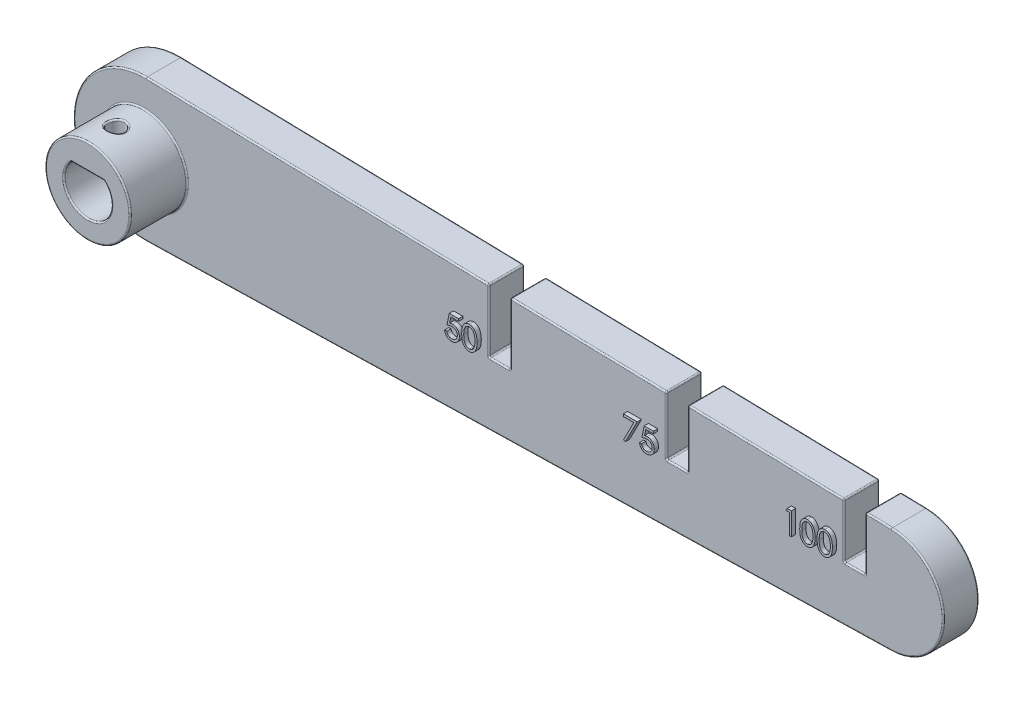
from build123d import *

# Parameters (mm, degrees)
BOSS_EXTRUDE1_DEPTH = 5
CUT_EXTRUDE2_REACH  = 115.054
CUT_EXTRUDE3_REACH  = 115.054
SKETCH4_W           = 3
SKETCH4_H           = 7.656932545
SKETCH4_H_2         = 8.25233943
SKETCH4_H_3         = 8.847746315
SKETCH6_R           = 6
BOSS_EXTRUDE3_DEPTH = 8
CUT_EXTRUDE4_REACH  = 115.689
SKETCH7_R           = 1.15
FILLET1_R           = 0.2
BOSS_EXTRUDE2_DEPTH = 0.6


with BuildPart() as part:
    # Sketch3 → Boss-Extrude1 (new body)
    with BuildSketch(Plane.XY):
        with BuildLine():
            Line((0.238095238, 9.997165131), (105.178571429, 7.497873848))
            ThreePointArc((105.178571429, 7.497873848), (112.5, 0), (105.178571429, -7.497873848))
            Line((105.178571429, -7.497873848), (0.238095238, -9.997165131))
            ThreePointArc((0.238095238, -9.997165131), (-10, 0), (0.238095238, 9.997165131))
        make_face()
    extrude(amount=BOSS_EXTRUDE1_DEPTH)

    # Sketch2 → Cut-Extrude2 (cut, up to next)
    with BuildSketch(Plane.XY, mode=Mode.PRIVATE) as cut_extrude2_sk1:
        with BuildLine():
            Line((-2.3, 2.435672392), (2.3, 2.435672392))
            ThreePointArc((2.3, 2.435672392), (0, -3.35), (-2.3, 2.435672392))
        make_face()
    cut_extrude2_tool1 = extrude(cut_extrude2_sk1.sketch, amount=CUT_EXTRUDE2_REACH, mode=Mode.PRIVATE) & part.part
    add(cut_extrude2_tool1.solids().sort_by_distance((0, -0.250614, 0))[0], mode=Mode.SUBTRACT)

    # Sketch4 → Cut-Extrude3 (cut, up to next)
    with BuildSketch(Plane.XY.offset(5), mode=Mode.PRIVATE) as cut_extrude3_sk1:
        with Locations((100, 3.828466273)):
            Rectangle(SKETCH4_W, SKETCH4_H)
    cut_extrude3_tool1 = extrude(cut_extrude3_sk1.sketch, amount=-CUT_EXTRUDE3_REACH, mode=Mode.PRIVATE) & part.part
    # Sketch4 → Cut-Extrude3 (cut, up to next)
    with BuildSketch(Plane.XY.offset(5), mode=Mode.PRIVATE) as cut_extrude3_sk2:
        with Locations((75, 4.126169715)):
            Rectangle(SKETCH4_W, SKETCH4_H_2)
    cut_extrude3_tool2 = extrude(cut_extrude3_sk2.sketch, amount=-CUT_EXTRUDE3_REACH, mode=Mode.PRIVATE) & part.part
    # Sketch4 → Cut-Extrude3 (cut, up to next)
    with BuildSketch(Plane.XY.offset(5), mode=Mode.PRIVATE) as cut_extrude3_sk3:
        with Locations((50, 4.423873158)):
            Rectangle(SKETCH4_W, SKETCH4_H_3)
    cut_extrude3_tool3 = extrude(cut_extrude3_sk3.sketch, amount=-CUT_EXTRUDE3_REACH, mode=Mode.PRIVATE) & part.part
    add(cut_extrude3_tool1.solids().sort_by_distance((100, 3.828466, 5))[0], mode=Mode.SUBTRACT)
    add(cut_extrude3_tool2.solids().sort_by_distance((75, 4.12617, 5))[0], mode=Mode.SUBTRACT)
    add(cut_extrude3_tool3.solids().sort_by_distance((50, 4.423873, 5))[0], mode=Mode.SUBTRACT)

    # Sketch6 → Boss-Extrude3 (add)
    with BuildSketch(Plane.XY.offset(5)):
        Circle(SKETCH6_R)
        with BuildLine():
            Line((-2.3, 2.435672392), (2.3, 2.435672392))
            ThreePointArc((2.3, 2.435672392), (0, -3.35), (-2.3, 2.435672392))
        make_face(mode=Mode.SUBTRACT)
    extrude(amount=BOSS_EXTRUDE3_DEPTH)

    # Sketch7 → Cut-Extrude4 (cut, up to next)
    with BuildSketch(Plane(origin=(0, 0, 0), x_dir=(1, 0, 0), z_dir=(0, 1, 0)), mode=Mode.PRIVATE) as cut_extrude4_sk1:
        with Locations((0, -9)):
            Circle(SKETCH7_R)
    cut_extrude4_tool1 = extrude(cut_extrude4_sk1.sketch, amount=CUT_EXTRUDE4_REACH, mode=Mode.PRIVATE) & part.part
    add(cut_extrude4_tool1.solids().sort_by_distance((0, 0, 9))[0], mode=Mode.SUBTRACT)

    # Fillet1
    fillet1_edges = [part.edges().sort_by_distance(p)[0] for p in [
        (51.5, 0, 2.5),
        (48.5, 0, 2.5),
        (101.5, 0, 2.5),
        (98.5, 0, 2.5),
        (76.5, 0, 2.5),
        (73.5, 0, 2.5),
        (0, 2.435672392, 0),
        (0, -3.35, 0),
        (76.5, 4.090445302, 0),
        (75, 0, 0),
        (73.5, 4.126169715, 0),
        (62.5, 8.51431846, 0),
        (51.5, 4.388148745, 0),
        (50, 0, 0),
        (48.5, 4.423873158, 0),
        (24.369047619, 9.422455723, 0),
        (-10, 0, 0),
        (52.708333333, -8.74751949, 0),
        (112.5, 0, 0),
        (103.339285714, 7.541678783, 0),
        (101.5, 3.792741859, 0),
        (100, 0, 0),
        (98.5, 3.828466272, 0),
        (87.5, 7.918911574, 0),
        (100, 0, 5),
        (101.5, 3.792741859, 5),
        (103.339285714, 7.541678783, 5),
        (112.5, 0, 5),
        (52.708333333, -8.74751949, 5),
        (-10, 0, 5),
        (24.369047619, 9.422455723, 5),
        (48.5, 4.423873158, 5),
        (50, 0, 5),
        (51.5, 4.388148745, 5),
        (62.5, 8.51431846, 5),
        (73.5, 4.126169715, 5),
        (75, 0, 5),
        (76.5, 4.090445302, 5),
        (87.5, 7.918911574, 5),
        (98.5, 3.828466272, 5),
        (101.5, 7.585483719, 2.5),
        (98.5, 7.656932545, 2.5),
        (76.5, 8.180890604, 2.5),
        (73.5, 8.25233943, 2.5),
        (51.5, 8.776297489, 2.5),
        (48.5, 8.847746315, 2.5),
        (-6, 0, 5),
        (0, 2.435672392, 13),
        (2.3, 2.435672392, 6.5),
        (0, -3.35, 13),
        (-2.3, 2.435672392, 6.5),
        (-1.150000012, 5.888760487, 9.000000001),
        (-1.15, 2.435672392, 9),
        (-6, 0, 13),
    ]]
    fillet(fillet1_edges, radius=FILLET1_R)

    # Sketch5 → Boss-Extrude2 (add)
    # profile 1 of 7: a face of its own
    with BuildSketch(Plane.XY.offset(5)):
        with BuildLine():
            Line((44.816666667, 3.175), (44.816666667, 2.849358974))
            Line((44.816666667, 2.849358974), (43.736708734, 2.849358974))
            Line((43.736708734, 2.849358974), (43.565619992, 2.014267829))
            add(Edge.make_bspline(
                [(43.565619992, 2.014267829), (43.599234964, 2.023548147), (43.664358655, 2.041527295), (43.760479386, 2.061489672), (43.851730885, 2.073523325), (43.910944971, 2.075166443), (43.939598357, 2.075961538)],
                knots=[0, 0, 0, 0, 1.100273476, 2.13160584, 3.095893838, 4, 4, 4, 4], degree=3))
            add(Edge.make_bspline(
                [(43.939598357, 2.075961538), (43.975052893, 2.075194154), (44.044765367, 2.073685284), (44.146763555, 2.059196535), (44.244129822, 2.036391041), (44.336660544, 2.004531711), (44.424526901, 1.963792167), (44.506920474, 1.912901507), (44.58507801, 1.853453414), (44.657597363, 1.785104724), (44.723387271, 1.709882972), (44.781232133, 1.629004046), (44.83036534, 1.543253952), (44.869881167, 1.4518134), (44.901435528, 1.355693311), (44.922437695, 1.253882325), (44.936422852, 1.147340102), (44.937985302, 1.074492385), (44.938782051, 1.037344752)],
                knots=[0, 0, 0, 0, 1.052922333, 2.070308379, 3.05430497, 4.020497103, 4.973039431, 5.925935799, 6.892292201, 7.88610001, 8.88166317, 9.857072816, 10.836096531, 11.812156883, 12.81219415, 13.836441305, 14.89672472, 16, 16, 16, 16], degree=3))
            add(Edge.make_bspline(
                [(44.938782051, 1.037344752), (44.938178733, 1.011471023), (44.93698025, 0.960073227), (44.930885531, 0.883742417), (44.919150989, 0.809027561), (44.903395982, 0.735918748), (44.882946788, 0.664554389), (44.858191718, 0.594730218), (44.82789675, 0.526880824), (44.79466686, 0.460364216), (44.757250412, 0.396684142), (44.715722766, 0.337131132), (44.671848356, 0.28081182), (44.624639385, 0.228330219), (44.573657054, 0.180031196), (44.519518798, 0.135628112), (44.462656617, 0.094370048), (44.40219079, 0.057931757), (44.339468681, 0.024401075), (44.273584512, -0.003106705), (44.20603802, -0.027699827), (44.135857025, -0.047302756), (44.063200495, -0.062663002), (43.987948663, -0.073095689), (43.910496198, -0.080694315), (43.857995294, -0.081169982), (43.831475361, -0.081410256)],
                knots=[0, 0, 0, 0, 1.056347294, 2.098418968, 3.122841568, 4.141288669, 5.149314143, 6.15115421, 7.162517403, 8.180376062, 9.185164535, 10.17417709, 11.141909838, 12.097768115, 13.052685741, 14.0056014, 14.954263652, 15.917497458, 16.885230207, 17.854509472, 18.828990115, 19.81800267, 20.826176721, 21.857883937, 22.917946725, 24, 24, 24, 24], degree=3))
            add(Edge.make_bspline(
                [(43.831475361, -0.081410256), (43.799839497, -0.080783568), (43.737599672, -0.079550632), (43.646413157, -0.066652434), (43.558679194, -0.048179453), (43.47510403, -0.02038798), (43.39493867, 0.014434781), (43.319262347, 0.058445879), (43.246141393, 0.10831978), (43.178548331, 0.167175529), (43.115813857, 0.231506183), (43.05965581, 0.301317758), (43.009641779, 0.375458038), (42.96657268, 0.454287077), (42.929835189, 0.537597745), (42.90097445, 0.625702181), (42.877680514, 0.718140042), (42.867825839, 0.781779298), (42.862820513, 0.814102564)],
                knots=[0, 0, 0, 0, 1.0467383, 2.05933395, 3.04377827, 4.011590433, 4.970194871, 5.932262533, 6.905835911, 7.896367577, 8.894135286, 9.877477877, 10.858688626, 11.851381753, 12.8477658, 13.868841284, 14.917554742, 16, 16, 16, 16], degree=3))
            Line((42.862820513, 0.814102564), (43.14775641, 0.814102564))
            add(Edge.make_bspline(
                [(43.14775641, 0.814102564), (43.154767316, 0.783825354), (43.168242666, 0.725630874), (43.197820738, 0.643868872), (43.233984782, 0.571007861), (43.276987298, 0.506084025), (43.328286254, 0.449470149), (43.386823665, 0.399017529), (43.452453385, 0.353501518), (43.525381529, 0.315562294), (43.602319108, 0.283205639), (43.682843649, 0.261659459), (43.764762592, 0.246509363), (43.820169399, 0.244992837), (43.848011819, 0.244230769)],
                knots=[0, 0, 0, 0, 1.136247022, 2.183929868, 3.172523383, 4.106158343, 5.02341133, 5.958108904, 6.928429099, 7.938127109, 8.96079061, 9.975095812, 10.982467395, 12, 12, 12, 12], degree=3))
            add(Edge.make_bspline(
                [(43.848011819, 0.244230769), (43.875188408, 0.244975332), (43.928699334, 0.246441382), (44.007449663, 0.257725343), (44.083479913, 0.275103997), (44.156039872, 0.301111651), (44.226399269, 0.332720789), (44.292778332, 0.37328375), (44.357097371, 0.419965339), (44.417357178, 0.473447424), (44.472547249, 0.532384219), (44.521311731, 0.59541014), (44.561930788, 0.662644708), (44.596161015, 0.732923925), (44.622153651, 0.807018045), (44.640696541, 0.884579825), (44.65158503, 0.965800843), (44.653082886, 1.021199431), (44.653846154, 1.049429087)],
                knots=[0, 0, 0, 0, 1.027316725, 2.022795036, 3.002884548, 3.971462791, 4.93288096, 5.914575861, 6.907176829, 7.935150275, 8.956128384, 9.956726525, 10.942570165, 11.921478529, 12.907843606, 13.90538589, 14.932640048, 16, 16, 16, 16], degree=3))
            add(Edge.make_bspline(
                [(44.653846154, 1.049429087), (44.653248819, 1.074897804), (44.652079621, 1.124749195), (44.642526889, 1.197682761), (44.625910778, 1.266691878), (44.602847687, 1.33210979), (44.573565563, 1.393998198), (44.537782122, 1.452420974), (44.494825825, 1.506608094), (44.445756755, 1.556584911), (44.392001246, 1.602708476), (44.332634423, 1.642027754), (44.268898632, 1.675105737), (44.201561781, 1.703651707), (44.129022195, 1.724153812), (44.052716392, 1.739546108), (43.971820379, 1.748450044), (43.916511254, 1.749685471), (43.888080929, 1.750320513)],
                knots=[0, 0, 0, 0, 1.045622112, 2.046656509, 3.013763289, 3.955457236, 4.890082067, 5.820317437, 6.762574623, 7.722996705, 8.69280354, 9.665887285, 10.63943826, 11.638615906, 12.663482002, 13.728887084, 14.832589034, 16, 16, 16, 16], degree=3))
            add(Edge.make_bspline(
                [(43.888080929, 1.750320513), (43.863471115, 1.749793834), (43.812658093, 1.748706375), (43.734713815, 1.740699481), (43.652806323, 1.727782407), (43.567249602, 1.710014883), (43.477786713, 1.686763834), (43.384606449, 1.658901395), (43.287512893, 1.625589296), (43.222091814, 1.600432216), (43.188461538, 1.5875)],
                knots=[0, 0, 0, 0, 0.817624296, 1.688186739, 2.600797293, 3.572016777, 4.590301741, 5.671205678, 6.80286297, 8, 8, 8, 8], degree=3))
            Line((43.188461538, 1.5875), (43.514102564, 3.175))
            Line((43.514102564, 3.175), (44.816666667, 3.175))
        make_face()
    # profile 2 of 7: a face of its own
    with BuildSketch(Plane.XY.offset(5)):
        with BuildLine():
            add(Edge.make_bspline(
                [(45.264423077, 1.586227965), (45.264720636, 1.637116309), (45.26529865, 1.735967652), (45.27172886, 1.880008006), (45.282410778, 2.015136268), (45.29704968, 2.141358907), (45.314864134, 2.258708507), (45.338645325, 2.366871466), (45.365689796, 2.466348394), (45.3970338, 2.557463681), (45.432401295, 2.641444883), (45.470895231, 2.719844887), (45.514043295, 2.792545069), (45.559379494, 2.860705779), (45.608739016, 2.923211273), (45.660717205, 2.98094426), (45.717342764, 3.032570441), (45.776690779, 3.079602444), (45.839298571, 3.120831607), (45.903381561, 3.15714702), (45.969380836, 3.188171185), (46.037476588, 3.212564652), (46.107056765, 3.232713063), (46.178364604, 3.246491609), (46.251517842, 3.25516109), (46.300894929, 3.255989917), (46.325936498, 3.256410256)],
                knots=[0, 0, 0, 0, 1.646270934, 3.197905019, 4.663502075, 6.030701355, 7.308322542, 8.50163776, 9.611534131, 10.641858119, 11.616356847, 12.558055219, 13.465016945, 14.349605745, 15.204443733, 16.039544428, 16.859896111, 17.680448484, 18.487036065, 19.28249412, 20.06191084, 20.843045899, 21.620316918, 22.403196591, 23.190181807, 24, 24, 24, 24], degree=3))
            add(Edge.make_bspline(
                [(46.325936498, 3.256410256), (46.351187254, 3.255967738), (46.401403062, 3.255087709), (46.475643974, 3.246629561), (46.548169756, 3.232595043), (46.618671211, 3.212709587), (46.687727449, 3.188039223), (46.754798333, 3.157117338), (46.820300471, 3.121122937), (46.883192946, 3.07882842), (46.944166204, 3.031673069), (47.001722571, 2.978366934), (47.055867284, 2.91944826), (47.107279883, 2.855547427), (47.154501746, 2.785438814), (47.199471931, 2.7103418), (47.239723706, 2.628943087), (47.278490162, 2.542600805), (47.311951928, 2.448925915), (47.342129165, 2.348446454), (47.366512229, 2.239975584), (47.386822498, 2.124082419), (47.402556796, 2.000341345), (47.414016407, 1.869017616), (47.420069849, 1.730024833), (47.421209856, 1.634994498), (47.421794872, 1.586227965)],
                knots=[0, 0, 0, 0, 0.810914788, 1.612654377, 2.396697861, 3.181598691, 3.963628158, 4.749916497, 5.551656086, 6.361998678, 7.18212741, 8.025565596, 8.878627764, 9.750805457, 10.657531673, 11.591944965, 12.560506719, 13.57287815, 14.630710178, 15.753379473, 16.941251878, 18.199788006, 19.531962791, 20.947069417, 22.433333509, 24, 24, 24, 24], degree=3))
            add(Edge.make_bspline(
                [(47.421794872, 1.586227965), (47.421203792, 1.537674134), (47.420052096, 1.443068975), (47.414084269, 1.30470159), (47.402328939, 1.174074794), (47.387624164, 1.050875303), (47.367257933, 0.935615891), (47.342216104, 0.827897713), (47.314411883, 0.727255591), (47.280090319, 0.634514012), (47.242524889, 0.548379235), (47.20165339, 0.467945464), (47.157865762, 0.392501756), (47.110160258, 0.322651986), (47.059311804, 0.257901347), (47.004232096, 0.199392789), (46.946473779, 0.145716537), (46.885321088, 0.097953989), (46.821447752, 0.056148487), (46.756170589, 0.018761637), (46.688331377, -0.011385165), (46.619467484, -0.037270523), (46.548593895, -0.057046647), (46.475798955, -0.070720788), (46.401452941, -0.080310965), (46.351195807, -0.081042557), (46.325936498, -0.081410256)],
                knots=[0, 0, 0, 0, 1.561518951, 3.042555995, 4.452378317, 5.7783523, 7.031515105, 8.214008947, 9.334062868, 10.386615937, 11.391082383, 12.354592575, 13.286541444, 14.194233754, 15.072674879, 15.931287219, 16.775624067, 17.606195743, 18.42308326, 19.229000347, 20.022332153, 20.807536673, 21.593273796, 22.3848459, 23.188221202, 24, 24, 24, 24], degree=3))
            add(Edge.make_bspline(
                [(46.325936498, -0.081410256), (46.300895624, -0.080987205), (46.251519906, -0.080153031), (46.178356634, -0.071522718), (46.107343275, -0.057647511), (46.038129405, -0.038219592), (45.970359924, -0.01443899), (45.904958292, 0.01654328), (45.841197322, 0.052224899), (45.779247125, 0.092860746), (45.720271807, 0.139416844), (45.663939501, 0.190910163), (45.611665377, 0.248625686), (45.56301159, 0.311652088), (45.51677081, 0.379409529), (45.47423545, 0.452823125), (45.434891889, 0.531601779), (45.39892958, 0.616254455), (45.367044721, 0.708016425), (45.338880014, 0.807937466), (45.316642171, 0.916899507), (45.297607633, 1.034027404), (45.2822548, 1.15982447), (45.271773376, 1.294358997), (45.265295184, 1.437547151), (45.264719084, 1.535763303), (45.264423077, 1.586227965)],
                knots=[0, 0, 0, 0, 0.810891512, 1.598919785, 2.382837074, 3.152667961, 3.926044502, 4.706494248, 5.493654104, 6.291793342, 7.103789334, 7.925228297, 8.761435821, 9.622817696, 10.50288917, 11.416980706, 12.369136599, 13.353924996, 14.394355917, 15.514179734, 16.714354668, 17.994756427, 19.357759367, 20.818452758, 22.365282078, 24, 24, 24, 24], degree=3))
        make_face()
        with BuildLine():
            add(Edge.make_bspline(
                [(45.549358974, 1.5875), (45.54946733, 1.545092252), (45.549677627, 1.46278714), (45.555171466, 1.343186467), (45.562655605, 1.231634812), (45.572308782, 1.127990532), (45.586644313, 1.03260445), (45.6027069, 0.944820523), (45.622254095, 0.865103315), (45.645381719, 0.792905801), (45.671724328, 0.727002717), (45.700486076, 0.665678758), (45.731384017, 0.608209501), (45.765963532, 0.555111156), (45.803623625, 0.506210565), (45.843513653, 0.46064221), (45.887122355, 0.420004948), (45.94745075, 0.371267015), (46.027094694, 0.32090323), (46.12744325, 0.27704642), (46.230556774, 0.249485191), (46.300543979, 0.245980213), (46.335476763, 0.244230769)],
                knots=[0, 0, 0, 0, 1.459021318, 2.831673884, 4.118529203, 5.306027144, 6.411944654, 7.436330062, 8.375795394, 9.233974572, 10.042671642, 10.816086306, 11.563610507, 12.285937304, 12.993564865, 13.685989202, 14.367179055, 15.041617293, 16.353048772, 17.594441528, 18.799311195, 20, 20, 20, 20], degree=3))
            add(Edge.make_bspline(
                [(46.335476763, 0.244230769), (46.370635508, 0.245680185), (46.440880408, 0.248576023), (46.543508922, 0.276514878), (46.643140667, 0.318669388), (46.721220213, 0.368514626), (46.780622235, 0.415983896), (46.823182647, 0.456455755), (46.862246077, 0.501772864), (46.899295673, 0.550667225), (46.933276406, 0.604072978), (46.964176538, 0.661733315), (46.992373575, 0.723808354), (47.00843821, 0.767142332), (47.016651643, 0.789297877)],
                knots=[0, 0, 0, 0, 1.353760809, 2.704726607, 4.075137775, 5.516104923, 6.260822281, 7.007110065, 7.778089737, 8.566572457, 9.372053459, 10.217411131, 11.088608312, 12, 12, 12, 12], degree=3))
            add(Edge.make_bspline(
                [(47.016651643, 0.789297877), (47.026223603, 0.817627712), (47.045658789, 0.875149426), (47.070706613, 0.964379311), (47.090432796, 1.057998961), (47.108179564, 1.155448888), (47.120292693, 1.25744776), (47.130042495, 1.36367998), (47.135785332, 1.474225644), (47.136497214, 1.549332529), (47.136858974, 1.5875)],
                knots=[0, 0, 0, 0, 0.884706709, 1.796334032, 2.740027952, 3.714592787, 4.726048262, 5.777819803, 6.87074269, 8, 8, 8, 8], degree=3))
            add(Edge.make_bspline(
                [(47.136858974, 1.5875), (47.136359874, 1.625661298), (47.135383527, 1.700312955), (47.131651553, 1.809640161), (47.122014453, 1.913478773), (47.111310967, 2.01227613), (47.095529202, 2.105485333), (47.078513191, 2.193886682), (47.055652092, 2.276384997), (47.03123201, 2.354271903), (47.00328258, 2.426662497), (46.972516164, 2.493894289), (46.939657854, 2.556291861), (46.903968822, 2.613684015), (46.865872738, 2.666327822), (46.824364104, 2.713167775), (46.781089423, 2.755655596), (46.72047669, 2.804153784), (46.641125013, 2.853603679), (46.542386461, 2.89911119), (46.439633805, 2.925244427), (46.370170743, 2.928928957), (46.335476763, 2.930769231)],
                knots=[0, 0, 0, 0, 1.31362396, 2.569729283, 3.763502607, 4.902122613, 5.988968491, 7.01645872, 7.998833611, 8.933434873, 9.825090667, 10.667526885, 11.477055099, 12.250526234, 12.991942729, 13.710640831, 14.402115721, 15.076753259, 16.378508321, 17.609869233, 18.806226677, 20, 20, 20, 20], degree=3))
            add(Edge.make_bspline(
                [(46.335476763, 2.930769231), (46.300360726, 2.928926418), (46.230064678, 2.925237437), (46.126244034, 2.899208557), (46.026726515, 2.853839652), (45.947584674, 2.80399), (45.886929667, 2.756511674), (45.844218938, 2.715339677), (45.804172053, 2.670303432), (45.76728064, 2.620953123), (45.732728219, 2.567916683), (45.700995443, 2.510776875), (45.672404722, 2.449244137), (45.646020893, 2.383370657), (45.622822721, 2.311179371), (45.603687483, 2.231560356), (45.586009942, 2.144055639), (45.573495662, 2.048152943), (45.562370684, 1.944482704), (45.555221175, 1.832652565), (45.549659249, 1.712851306), (45.549461071, 1.630120641), (45.549358974, 1.5875)],
                knots=[0, 0, 0, 0, 1.207732386, 2.417664972, 3.655092373, 4.956220595, 5.625982001, 6.301752483, 6.994047911, 7.697131622, 8.419323945, 9.170223765, 9.943494443, 10.752040957, 11.610060368, 12.549350801, 13.567764191, 14.679664412, 15.874934091, 17.154273443, 18.533957287, 20, 20, 20, 20], degree=3))
        make_face(mode=Mode.SUBTRACT)
    # profile 3 of 7: a face of its own
    with BuildSketch(Plane.XY.offset(5)):
        Polygon((68.025641026, 3.175), (69.979487179, 3.175), (68.310576923, -0.081410256), (68.064438101, 0.054061498), (69.497385817, 2.849358974), (68.025641026, 2.849358974), align=None)
    # profile 4 of 7: a face of its own
    with BuildSketch(Plane.XY.offset(5)):
        with BuildLine():
            Line((72.258974359, 3.175), (72.258974359, 2.849358974))
            Line((72.258974359, 2.849358974), (71.179016426, 2.849358974))
            Line((71.179016426, 2.849358974), (71.007927684, 2.014267829))
            add(Edge.make_bspline(
                [(71.007927684, 2.014267829), (71.041542656, 2.023548147), (71.106666347, 2.041527295), (71.202787078, 2.061489672), (71.294038577, 2.073523325), (71.353252663, 2.075166443), (71.38190605, 2.075961538)],
                knots=[0, 0, 0, 0, 1.100273476, 2.13160584, 3.095893838, 4, 4, 4, 4], degree=3))
            add(Edge.make_bspline(
                [(71.38190605, 2.075961538), (71.417360585, 2.075194154), (71.48707306, 2.073685284), (71.589071247, 2.059196535), (71.686437515, 2.036391041), (71.778968236, 2.004531711), (71.866834593, 1.963792167), (71.949228167, 1.912901507), (72.027385702, 1.853453414), (72.099905055, 1.785104724), (72.165694963, 1.709882972), (72.223539825, 1.629004046), (72.272673032, 1.543253952), (72.31218886, 1.4518134), (72.34374322, 1.355693311), (72.364745387, 1.253882325), (72.378730544, 1.147340102), (72.380292995, 1.074492385), (72.381089744, 1.037344752)],
                knots=[0, 0, 0, 0, 1.052922333, 2.070308379, 3.05430497, 4.020497103, 4.973039431, 5.925935799, 6.892292201, 7.88610001, 8.88166317, 9.857072816, 10.836096531, 11.812156883, 12.81219415, 13.836441305, 14.89672472, 16, 16, 16, 16], degree=3))
            add(Edge.make_bspline(
                [(72.381089744, 1.037344752), (72.380486425, 1.011471023), (72.379287942, 0.960073227), (72.373193223, 0.883742417), (72.361458681, 0.809027561), (72.345703674, 0.735918748), (72.325254481, 0.664554389), (72.30049941, 0.594730218), (72.270204442, 0.526880824), (72.236974552, 0.460364216), (72.199558104, 0.396684142), (72.158030458, 0.337131132), (72.114156048, 0.28081182), (72.066947077, 0.228330219), (72.015964746, 0.180031196), (71.96182649, 0.135628112), (71.904964309, 0.094370048), (71.844498482, 0.057931757), (71.781776373, 0.024401075), (71.715892204, -0.003106705), (71.648345712, -0.027699827), (71.578164718, -0.047302756), (71.505508188, -0.062663002), (71.430256356, -0.073095689), (71.352803891, -0.080694315), (71.300302986, -0.081169982), (71.273783053, -0.081410256)],
                knots=[0, 0, 0, 0, 1.056347294, 2.098418968, 3.122841568, 4.141288669, 5.149314143, 6.15115421, 7.162517403, 8.180376062, 9.185164535, 10.17417709, 11.141909838, 12.097768115, 13.052685741, 14.0056014, 14.954263652, 15.917497458, 16.885230207, 17.854509472, 18.828990115, 19.81800267, 20.826176721, 21.857883937, 22.917946725, 24, 24, 24, 24], degree=3))
            add(Edge.make_bspline(
                [(71.273783053, -0.081410256), (71.242147189, -0.080783568), (71.179907364, -0.079550632), (71.08872085, -0.066652434), (71.000986886, -0.048179453), (70.917411723, -0.02038798), (70.837246362, 0.014434781), (70.761570039, 0.058445879), (70.688449085, 0.10831978), (70.620856024, 0.167175529), (70.558121549, 0.231506183), (70.501963502, 0.301317758), (70.451949471, 0.375458038), (70.408880372, 0.454287077), (70.372142882, 0.537597745), (70.343282142, 0.625702181), (70.319988206, 0.718140042), (70.310133532, 0.781779298), (70.305128205, 0.814102564)],
                knots=[0, 0, 0, 0, 1.0467383, 2.05933395, 3.04377827, 4.011590433, 4.970194871, 5.932262533, 6.905835911, 7.896367577, 8.894135286, 9.877477877, 10.858688626, 11.851381753, 12.8477658, 13.868841284, 14.917554742, 16, 16, 16, 16], degree=3))
            Line((70.305128205, 0.814102564), (70.590064103, 0.814102564))
            add(Edge.make_bspline(
                [(70.590064103, 0.814102564), (70.597075008, 0.783825354), (70.610550358, 0.725630874), (70.64012843, 0.643868872), (70.676292474, 0.571007861), (70.71929499, 0.506084025), (70.770593947, 0.449470149), (70.829131357, 0.399017529), (70.894761078, 0.353501518), (70.967689221, 0.315562294), (71.044626801, 0.283205639), (71.125151341, 0.261659459), (71.207070284, 0.246509363), (71.262477091, 0.244992837), (71.290319511, 0.244230769)],
                knots=[0, 0, 0, 0, 1.136247022, 2.183929868, 3.172523383, 4.106158343, 5.02341133, 5.958108904, 6.928429099, 7.938127109, 8.96079061, 9.975095812, 10.982467395, 12, 12, 12, 12], degree=3))
            add(Edge.make_bspline(
                [(71.290319511, 0.244230769), (71.3174961, 0.244975332), (71.371007026, 0.246441382), (71.449757355, 0.257725343), (71.525787605, 0.275103997), (71.598347565, 0.301111651), (71.668706961, 0.332720789), (71.735086025, 0.37328375), (71.799405063, 0.419965339), (71.85966487, 0.473447424), (71.914854942, 0.532384219), (71.963619423, 0.59541014), (72.00423848, 0.662644708), (72.038468708, 0.732923925), (72.064461343, 0.807018045), (72.083004233, 0.884579825), (72.093892722, 0.965800843), (72.095390578, 1.021199431), (72.096153846, 1.049429087)],
                knots=[0, 0, 0, 0, 1.027316725, 2.022795036, 3.002884548, 3.971462791, 4.93288096, 5.914575861, 6.907176829, 7.935150275, 8.956128384, 9.956726525, 10.942570165, 11.921478529, 12.907843606, 13.90538589, 14.932640048, 16, 16, 16, 16], degree=3))
            add(Edge.make_bspline(
                [(72.096153846, 1.049429087), (72.095556511, 1.074897804), (72.094387313, 1.124749195), (72.084834581, 1.197682761), (72.068218471, 1.266691878), (72.04515538, 1.33210979), (72.015873255, 1.393998198), (71.980089814, 1.452420974), (71.937133518, 1.506608094), (71.888064447, 1.556584911), (71.834308939, 1.602708476), (71.774942115, 1.642027754), (71.711206324, 1.675105737), (71.643869473, 1.703651707), (71.571329887, 1.724153812), (71.495024085, 1.739546108), (71.414128071, 1.748450044), (71.358818947, 1.749685471), (71.330388622, 1.750320513)],
                knots=[0, 0, 0, 0, 1.045622112, 2.046656509, 3.013763289, 3.955457236, 4.890082067, 5.820317437, 6.762574623, 7.722996705, 8.69280354, 9.665887285, 10.63943826, 11.638615906, 12.663482002, 13.728887084, 14.832589034, 16, 16, 16, 16], degree=3))
            add(Edge.make_bspline(
                [(71.330388622, 1.750320513), (71.305778808, 1.749793834), (71.254965785, 1.748706375), (71.177021507, 1.740699481), (71.095114015, 1.727782407), (71.009557294, 1.710014883), (70.920094405, 1.686763834), (70.826914141, 1.658901395), (70.729820585, 1.625589296), (70.664399507, 1.600432216), (70.630769231, 1.5875)],
                knots=[0, 0, 0, 0, 0.817624296, 1.688186739, 2.600797293, 3.572016777, 4.590301741, 5.671205678, 6.80286297, 8, 8, 8, 8], degree=3))
            Line((70.630769231, 1.5875), (70.956410256, 3.175))
            Line((70.956410256, 3.175), (72.258974359, 3.175))
        make_face()
    # profile 5 of 7: a face of its own
    with BuildSketch(Plane.XY.offset(5)):
        Polygon((91.096930088, 3.175), (91.683974359, 3.175), (91.683974359, 0), (91.399038462, 0), (91.399038462, 2.849358974), (90.910576923, 2.849358974), align=None)
    # profile 6 of 7: a face of its own
    with BuildSketch(Plane.XY.offset(5)):
        with BuildLine():
            add(Edge.make_bspline(
                [(92.864423077, 1.586227965), (92.864720636, 1.637116309), (92.86529865, 1.735967652), (92.87172886, 1.880008006), (92.882410778, 2.015136268), (92.89704968, 2.141358907), (92.914864134, 2.258708507), (92.938645325, 2.366871466), (92.965689796, 2.466348394), (92.9970338, 2.557463681), (93.032401295, 2.641444883), (93.070895231, 2.719844887), (93.114043295, 2.792545069), (93.159379494, 2.860705779), (93.208739016, 2.923211273), (93.260717205, 2.98094426), (93.317342764, 3.032570441), (93.376690779, 3.079602444), (93.439298571, 3.120831607), (93.503381561, 3.15714702), (93.569380836, 3.188171185), (93.637476588, 3.212564652), (93.707056765, 3.232713063), (93.778364604, 3.246491609), (93.851517842, 3.25516109), (93.900894929, 3.255989917), (93.925936498, 3.256410256)],
                knots=[0, 0, 0, 0, 1.646270934, 3.197905019, 4.663502075, 6.030701355, 7.308322542, 8.50163776, 9.611534131, 10.641858119, 11.616356847, 12.558055219, 13.465016945, 14.349605745, 15.204443733, 16.039544428, 16.859896111, 17.680448484, 18.487036065, 19.28249412, 20.06191084, 20.843045899, 21.620316918, 22.403196591, 23.190181807, 24, 24, 24, 24], degree=3))
            add(Edge.make_bspline(
                [(93.925936498, 3.256410256), (93.951187254, 3.255967738), (94.001403062, 3.255087709), (94.075643974, 3.246629561), (94.148169756, 3.232595043), (94.218671211, 3.212709587), (94.287727449, 3.188039223), (94.354798333, 3.157117338), (94.420300471, 3.121122937), (94.483192946, 3.07882842), (94.544166204, 3.031673069), (94.601722571, 2.978366934), (94.655867284, 2.91944826), (94.707279883, 2.855547427), (94.754501746, 2.785438814), (94.799471931, 2.7103418), (94.839723706, 2.628943087), (94.878490162, 2.542600805), (94.911951928, 2.448925915), (94.942129165, 2.348446454), (94.966512229, 2.239975584), (94.986822498, 2.124082419), (95.002556796, 2.000341345), (95.014016407, 1.869017616), (95.020069849, 1.730024833), (95.021209856, 1.634994498), (95.021794872, 1.586227965)],
                knots=[0, 0, 0, 0, 0.810914788, 1.612654377, 2.396697861, 3.181598691, 3.963628158, 4.749916497, 5.551656086, 6.361998678, 7.18212741, 8.025565596, 8.878627764, 9.750805457, 10.657531673, 11.591944965, 12.560506719, 13.57287815, 14.630710178, 15.753379473, 16.941251878, 18.199788006, 19.531962791, 20.947069417, 22.433333509, 24, 24, 24, 24], degree=3))
            add(Edge.make_bspline(
                [(95.021794872, 1.586227965), (95.021203792, 1.537674134), (95.020052096, 1.443068975), (95.014084269, 1.30470159), (95.002328939, 1.174074794), (94.987624164, 1.050875303), (94.967257933, 0.935615891), (94.942216104, 0.827897713), (94.914411883, 0.727255591), (94.880090319, 0.634514012), (94.842524889, 0.548379235), (94.80165339, 0.467945464), (94.757865762, 0.392501756), (94.710160258, 0.322651986), (94.659311804, 0.257901347), (94.604232096, 0.199392789), (94.546473779, 0.145716537), (94.485321088, 0.097953989), (94.421447752, 0.056148487), (94.356170589, 0.018761637), (94.288331377, -0.011385165), (94.219467484, -0.037270523), (94.148593895, -0.057046647), (94.075798955, -0.070720788), (94.001452941, -0.080310965), (93.951195807, -0.081042557), (93.925936498, -0.081410256)],
                knots=[0, 0, 0, 0, 1.561518951, 3.042555995, 4.452378317, 5.7783523, 7.031515105, 8.214008947, 9.334062868, 10.386615937, 11.391082383, 12.354592575, 13.286541444, 14.194233754, 15.072674879, 15.931287219, 16.775624067, 17.606195743, 18.42308326, 19.229000347, 20.022332153, 20.807536673, 21.593273796, 22.3848459, 23.188221202, 24, 24, 24, 24], degree=3))
            add(Edge.make_bspline(
                [(93.925936498, -0.081410256), (93.900895624, -0.080987205), (93.851519906, -0.080153031), (93.778356634, -0.071522718), (93.707343275, -0.057647511), (93.638129405, -0.038219592), (93.570359924, -0.01443899), (93.504958292, 0.01654328), (93.441197322, 0.052224899), (93.379247125, 0.092860746), (93.320271807, 0.139416844), (93.263939501, 0.190910163), (93.211665377, 0.248625686), (93.16301159, 0.311652088), (93.11677081, 0.379409529), (93.07423545, 0.452823125), (93.034891889, 0.531601779), (92.99892958, 0.616254455), (92.967044721, 0.708016425), (92.938880014, 0.807937466), (92.916642171, 0.916899507), (92.897607633, 1.034027404), (92.8822548, 1.15982447), (92.871773376, 1.294358997), (92.865295184, 1.437547151), (92.864719084, 1.535763303), (92.864423077, 1.586227965)],
                knots=[0, 0, 0, 0, 0.810891512, 1.598919785, 2.382837074, 3.152667961, 3.926044502, 4.706494248, 5.493654104, 6.291793342, 7.103789334, 7.925228297, 8.761435821, 9.622817696, 10.50288917, 11.416980706, 12.369136599, 13.353924996, 14.394355917, 15.514179734, 16.714354668, 17.994756427, 19.357759367, 20.818452758, 22.365282078, 24, 24, 24, 24], degree=3))
        make_face()
        with BuildLine():
            add(Edge.make_bspline(
                [(93.149358974, 1.5875), (93.14946733, 1.545092252), (93.149677627, 1.46278714), (93.155171466, 1.343186467), (93.162655605, 1.231634812), (93.172308782, 1.127990532), (93.186644313, 1.03260445), (93.2027069, 0.944820523), (93.222254095, 0.865103315), (93.245381719, 0.792905801), (93.271724328, 0.727002717), (93.300486076, 0.665678758), (93.331384017, 0.608209501), (93.365963532, 0.555111156), (93.403623625, 0.506210565), (93.443513653, 0.46064221), (93.487122355, 0.420004948), (93.54745075, 0.371267015), (93.627094694, 0.32090323), (93.72744325, 0.27704642), (93.830556774, 0.249485191), (93.900543979, 0.245980213), (93.935476763, 0.244230769)],
                knots=[0, 0, 0, 0, 1.459021318, 2.831673884, 4.118529203, 5.306027144, 6.411944654, 7.436330062, 8.375795394, 9.233974572, 10.042671642, 10.816086306, 11.563610507, 12.285937304, 12.993564865, 13.685989202, 14.367179055, 15.041617293, 16.353048772, 17.594441528, 18.799311195, 20, 20, 20, 20], degree=3))
            add(Edge.make_bspline(
                [(93.935476763, 0.244230769), (93.970635508, 0.245680185), (94.040880408, 0.248576023), (94.143508922, 0.276514878), (94.243140667, 0.318669388), (94.321220213, 0.368514626), (94.380622235, 0.415983896), (94.423182647, 0.456455755), (94.462246077, 0.501772864), (94.499295673, 0.550667225), (94.533276406, 0.604072978), (94.564176538, 0.661733315), (94.592373575, 0.723808354), (94.60843821, 0.767142332), (94.616651643, 0.789297877)],
                knots=[0, 0, 0, 0, 1.353760809, 2.704726607, 4.075137775, 5.516104923, 6.260822281, 7.007110065, 7.778089737, 8.566572457, 9.372053459, 10.217411131, 11.088608312, 12, 12, 12, 12], degree=3))
            add(Edge.make_bspline(
                [(94.616651643, 0.789297877), (94.626223603, 0.817627712), (94.645658789, 0.875149426), (94.670706613, 0.964379311), (94.690432796, 1.057998961), (94.708179564, 1.155448888), (94.720292693, 1.25744776), (94.730042495, 1.36367998), (94.735785332, 1.474225644), (94.736497214, 1.549332529), (94.736858974, 1.5875)],
                knots=[0, 0, 0, 0, 0.884706709, 1.796334032, 2.740027952, 3.714592787, 4.726048262, 5.777819803, 6.87074269, 8, 8, 8, 8], degree=3))
            add(Edge.make_bspline(
                [(94.736858974, 1.5875), (94.736359874, 1.625661298), (94.735383527, 1.700312955), (94.731651553, 1.809640161), (94.722014453, 1.913478773), (94.711310967, 2.01227613), (94.695529202, 2.105485333), (94.678513191, 2.193886682), (94.655652092, 2.276384997), (94.63123201, 2.354271903), (94.60328258, 2.426662497), (94.572516164, 2.493894289), (94.539657854, 2.556291861), (94.503968822, 2.613684015), (94.465872738, 2.666327822), (94.424364104, 2.713167775), (94.381089423, 2.755655596), (94.32047669, 2.804153784), (94.241125013, 2.853603679), (94.142386461, 2.89911119), (94.039633805, 2.925244427), (93.970170743, 2.928928957), (93.935476763, 2.930769231)],
                knots=[0, 0, 0, 0, 1.31362396, 2.569729283, 3.763502607, 4.902122613, 5.988968491, 7.01645872, 7.998833611, 8.933434873, 9.825090667, 10.667526885, 11.477055099, 12.250526234, 12.991942729, 13.710640831, 14.402115721, 15.076753259, 16.378508321, 17.609869233, 18.806226677, 20, 20, 20, 20], degree=3))
            add(Edge.make_bspline(
                [(93.935476763, 2.930769231), (93.900360726, 2.928926418), (93.830064678, 2.925237437), (93.726244034, 2.899208557), (93.626726515, 2.853839652), (93.547584674, 2.80399), (93.486929667, 2.756511674), (93.444218938, 2.715339677), (93.404172053, 2.670303432), (93.36728064, 2.620953123), (93.332728219, 2.567916683), (93.300995443, 2.510776875), (93.272404722, 2.449244137), (93.246020893, 2.383370657), (93.222822721, 2.311179371), (93.203687483, 2.231560356), (93.186009942, 2.144055639), (93.173495662, 2.048152943), (93.162370684, 1.944482704), (93.155221175, 1.832652565), (93.149659249, 1.712851306), (93.149461071, 1.630120641), (93.149358974, 1.5875)],
                knots=[0, 0, 0, 0, 1.207732386, 2.417664972, 3.655092373, 4.956220595, 5.625982001, 6.301752483, 6.994047911, 7.697131622, 8.419323945, 9.170223765, 9.943494443, 10.752040957, 11.610060368, 12.549350801, 13.567764191, 14.679664412, 15.874934091, 17.154273443, 18.533957287, 20, 20, 20, 20], degree=3))
        make_face(mode=Mode.SUBTRACT)
    # profile 7 of 7: a face of its own
    with BuildSketch(Plane.XY.offset(5)):
        with BuildLine():
            add(Edge.make_bspline(
                [(95.306730769, 1.586227965), (95.307028329, 1.637116309), (95.307606342, 1.735967652), (95.314036552, 1.880008006), (95.32471847, 2.015136268), (95.339357372, 2.141358907), (95.357171826, 2.258708507), (95.380953017, 2.366871466), (95.407997488, 2.466348394), (95.439341493, 2.557463681), (95.474708987, 2.641444883), (95.513202924, 2.719844887), (95.556350987, 2.792545069), (95.601687187, 2.860705779), (95.651046709, 2.923211273), (95.703024897, 2.98094426), (95.759650456, 3.032570441), (95.818998471, 3.079602444), (95.881606264, 3.120831607), (95.945689254, 3.15714702), (96.011688528, 3.188171185), (96.07978428, 3.212564652), (96.149364458, 3.232713063), (96.220672297, 3.246491609), (96.293825534, 3.25516109), (96.343202621, 3.255989917), (96.368244191, 3.256410256)],
                knots=[0, 0, 0, 0, 1.646270934, 3.197905019, 4.663502075, 6.030701355, 7.308322542, 8.50163776, 9.611534131, 10.641858119, 11.616356847, 12.558055219, 13.465016945, 14.349605745, 15.204443733, 16.039544428, 16.859896111, 17.680448484, 18.487036065, 19.28249412, 20.06191084, 20.843045899, 21.620316918, 22.403196591, 23.190181807, 24, 24, 24, 24], degree=3))
            add(Edge.make_bspline(
                [(96.368244191, 3.256410256), (96.393494946, 3.255967738), (96.443710754, 3.255087709), (96.517951666, 3.246629561), (96.590477449, 3.232595043), (96.660978903, 3.212709587), (96.730035141, 3.188039223), (96.797106025, 3.157117338), (96.862608163, 3.121122937), (96.925500638, 3.07882842), (96.986473897, 3.031673069), (97.044030263, 2.978366934), (97.098174977, 2.91944826), (97.149587575, 2.855547427), (97.196809438, 2.785438814), (97.241779623, 2.7103418), (97.282031399, 2.628943087), (97.320797854, 2.542600805), (97.354259621, 2.448925915), (97.384436857, 2.348446454), (97.408819922, 2.239975584), (97.42913019, 2.124082419), (97.444864489, 2.000341345), (97.4563241, 1.869017616), (97.462377541, 1.730024833), (97.463517549, 1.634994498), (97.464102564, 1.586227965)],
                knots=[0, 0, 0, 0, 0.810914788, 1.612654377, 2.396697861, 3.181598691, 3.963628158, 4.749916497, 5.551656086, 6.361998678, 7.18212741, 8.025565596, 8.878627764, 9.750805457, 10.657531673, 11.591944965, 12.560506719, 13.57287815, 14.630710178, 15.753379473, 16.941251878, 18.199788006, 19.531962791, 20.947069417, 22.433333509, 24, 24, 24, 24], degree=3))
            add(Edge.make_bspline(
                [(97.464102564, 1.586227965), (97.463511484, 1.537674134), (97.462359788, 1.443068975), (97.456391961, 1.30470159), (97.444636631, 1.174074794), (97.429931856, 1.050875303), (97.409565626, 0.935615891), (97.384523796, 0.827897713), (97.356719575, 0.727255591), (97.322398012, 0.634514012), (97.284832582, 0.548379235), (97.243961082, 0.467945464), (97.200173454, 0.392501756), (97.15246795, 0.322651986), (97.101619496, 0.257901347), (97.046539788, 0.199392789), (96.988781472, 0.145716537), (96.92762878, 0.097953989), (96.863755444, 0.056148487), (96.798478282, 0.018761637), (96.73063907, -0.011385165), (96.661775177, -0.037270523), (96.590901587, -0.057046647), (96.518106647, -0.070720788), (96.443760633, -0.080310965), (96.393503499, -0.081042557), (96.368244191, -0.081410256)],
                knots=[0, 0, 0, 0, 1.561518951, 3.042555995, 4.452378317, 5.7783523, 7.031515105, 8.214008947, 9.334062868, 10.386615937, 11.391082383, 12.354592575, 13.286541444, 14.194233754, 15.072674879, 15.931287219, 16.775624067, 17.606195743, 18.42308326, 19.229000347, 20.022332153, 20.807536673, 21.593273796, 22.3848459, 23.188221202, 24, 24, 24, 24], degree=3))
            add(Edge.make_bspline(
                [(96.368244191, -0.081410256), (96.343203316, -0.080987205), (96.293827598, -0.080153031), (96.220664327, -0.071522718), (96.149650967, -0.057647511), (96.080437098, -0.038219592), (96.012667616, -0.01443899), (95.947265985, 0.01654328), (95.883505014, 0.052224899), (95.821554817, 0.092860746), (95.7625795, 0.139416844), (95.706247193, 0.190910163), (95.653973069, 0.248625686), (95.605319282, 0.311652088), (95.559078502, 0.379409529), (95.516543142, 0.452823125), (95.477199582, 0.531601779), (95.441237272, 0.616254455), (95.409352413, 0.708016425), (95.381187707, 0.807937466), (95.358949864, 0.916899507), (95.339915326, 1.034027404), (95.324562492, 1.15982447), (95.314081069, 1.294358997), (95.307602876, 1.437547151), (95.307026776, 1.535763303), (95.306730769, 1.586227965)],
                knots=[0, 0, 0, 0, 0.810891512, 1.598919785, 2.382837074, 3.152667961, 3.926044502, 4.706494248, 5.493654104, 6.291793342, 7.103789334, 7.925228297, 8.761435821, 9.622817696, 10.50288917, 11.416980706, 12.369136599, 13.353924996, 14.394355917, 15.514179734, 16.714354668, 17.994756427, 19.357759367, 20.818452758, 22.365282078, 24, 24, 24, 24], degree=3))
        make_face()
        with BuildLine():
            add(Edge.make_bspline(
                [(95.591666667, 1.5875), (95.591775022, 1.545092252), (95.591985319, 1.46278714), (95.597479158, 1.343186467), (95.604963297, 1.231634812), (95.614616474, 1.127990532), (95.628952006, 1.03260445), (95.645014592, 0.944820523), (95.664561787, 0.865103315), (95.687689411, 0.792905801), (95.71403202, 0.727002717), (95.742793768, 0.665678758), (95.773691709, 0.608209501), (95.808271225, 0.555111156), (95.845931318, 0.506210565), (95.885821346, 0.46064221), (95.929430047, 0.420004948), (95.989758442, 0.371267015), (96.069402387, 0.32090323), (96.169750942, 0.27704642), (96.272864466, 0.249485191), (96.342851671, 0.245980213), (96.377784455, 0.244230769)],
                knots=[0, 0, 0, 0, 1.459021318, 2.831673884, 4.118529203, 5.306027144, 6.411944654, 7.436330062, 8.375795394, 9.233974572, 10.042671642, 10.816086306, 11.563610507, 12.285937304, 12.993564865, 13.685989202, 14.367179055, 15.041617293, 16.353048772, 17.594441528, 18.799311195, 20, 20, 20, 20], degree=3))
            add(Edge.make_bspline(
                [(96.377784455, 0.244230769), (96.4129432, 0.245680185), (96.4831881, 0.248576023), (96.585816615, 0.276514878), (96.68544836, 0.318669388), (96.763527905, 0.368514626), (96.822929927, 0.415983896), (96.86549034, 0.456455755), (96.904553769, 0.501772864), (96.941603366, 0.550667225), (96.975584099, 0.604072978), (97.006484231, 0.661733315), (97.034681267, 0.723808354), (97.050745902, 0.767142332), (97.058959335, 0.789297877)],
                knots=[0, 0, 0, 0, 1.353760809, 2.704726607, 4.075137775, 5.516104923, 6.260822281, 7.007110065, 7.778089737, 8.566572457, 9.372053459, 10.217411131, 11.088608312, 12, 12, 12, 12], degree=3))
            add(Edge.make_bspline(
                [(97.058959335, 0.789297877), (97.068531296, 0.817627712), (97.087966481, 0.875149426), (97.113014305, 0.964379311), (97.132740488, 1.057998961), (97.150487256, 1.155448888), (97.162600385, 1.25744776), (97.172350187, 1.36367998), (97.178093025, 1.474225644), (97.178804906, 1.549332529), (97.179166667, 1.5875)],
                knots=[0, 0, 0, 0, 0.884706709, 1.796334032, 2.740027952, 3.714592787, 4.726048262, 5.777819803, 6.87074269, 8, 8, 8, 8], degree=3))
            add(Edge.make_bspline(
                [(97.179166667, 1.5875), (97.178667566, 1.625661298), (97.17769122, 1.700312955), (97.173959245, 1.809640161), (97.164322145, 1.913478773), (97.153618659, 2.01227613), (97.137836894, 2.105485333), (97.120820884, 2.193886682), (97.097959784, 2.276384997), (97.073539702, 2.354271903), (97.045590272, 2.426662497), (97.014823856, 2.493894289), (96.981965546, 2.556291861), (96.946276514, 2.613684015), (96.90818043, 2.666327822), (96.866671796, 2.713167775), (96.823397115, 2.755655596), (96.762784382, 2.804153784), (96.683432705, 2.853603679), (96.584694153, 2.89911119), (96.481941498, 2.925244427), (96.412478436, 2.928928957), (96.377784455, 2.930769231)],
                knots=[0, 0, 0, 0, 1.31362396, 2.569729283, 3.763502607, 4.902122613, 5.988968491, 7.01645872, 7.998833611, 8.933434873, 9.825090667, 10.667526885, 11.477055099, 12.250526234, 12.991942729, 13.710640831, 14.402115721, 15.076753259, 16.378508321, 17.609869233, 18.806226677, 20, 20, 20, 20], degree=3))
            add(Edge.make_bspline(
                [(96.377784455, 2.930769231), (96.342668418, 2.928926418), (96.272372371, 2.925237437), (96.168551726, 2.899208557), (96.069034207, 2.853839652), (95.989892366, 2.80399), (95.92923736, 2.756511674), (95.886526631, 2.715339677), (95.846479746, 2.670303432), (95.809588332, 2.620953123), (95.775035911, 2.567916683), (95.743303135, 2.510776875), (95.714712415, 2.449244137), (95.688328585, 2.383370657), (95.665130413, 2.311179371), (95.645995175, 2.231560356), (95.628317634, 2.144055639), (95.615803355, 2.048152943), (95.604678376, 1.944482704), (95.597528868, 1.832652565), (95.591966941, 1.712851306), (95.591768763, 1.630120641), (95.591666667, 1.5875)],
                knots=[0, 0, 0, 0, 1.207732386, 2.417664972, 3.655092373, 4.956220595, 5.625982001, 6.301752483, 6.994047911, 7.697131622, 8.419323945, 9.170223765, 9.943494443, 10.752040957, 11.610060368, 12.549350801, 13.567764191, 14.679664412, 15.874934091, 17.154273443, 18.533957287, 20, 20, 20, 20], degree=3))
        make_face(mode=Mode.SUBTRACT)
    extrude(amount=BOSS_EXTRUDE2_DEPTH)


solid = part.part
